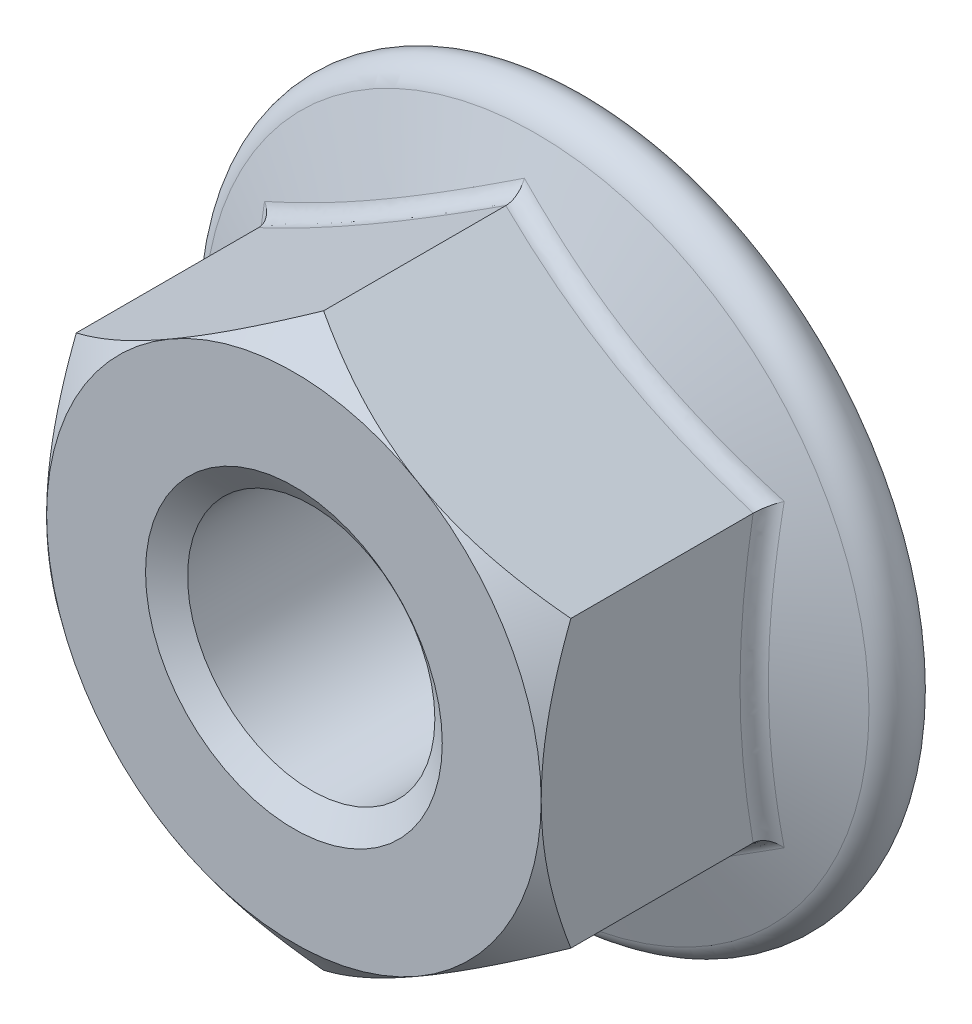
from build123d import *

# Parameters (mm, degrees)
BASENUT_START  = -6
BASENUTSKE_R   = 2.5
BASENUT_DEPTH  = 6
FLANGEFILLET_R = 0.36


# Read off the part's stored shape, not the designer's step: ThreadSchematic
with BuildPart() as part:
    # BaseNutSke → BaseNut (new body)
    with BuildSketch(Plane.XY.offset(BASENUT_START)):
        Polygon((5, 2.886751346), (5, -2.886751346), (0, -5.773502692), (-5, -2.886751346), (-5, 2.886751346), (0, 5.773502692), align=None)
        Circle(BASENUTSKE_R, mode=Mode.SUBTRACT)
    extrude(amount=BASENUT_DEPTH)

    # Sketch5 (on Right Plane) → EndChamfer (revolve, cut)
    with BuildSketch(Plane(origin=(0, 0, 0), x_dir=(0, 0, -1), z_dir=(1, 0, 0))):
        Polygon((5.9746, 3), (5.589485854, 2.45), (6.0254, 2.45), (6.0254, 3), align=None)
    revolve(axis=Axis((0, 2.45, -6.0254), (0, 0, 1)), mode=Mode.SUBTRACT)

    # Sketch6 → Flange (revolve)
    with BuildSketch(Plane(origin=(0, 0, 0), x_dir=(0, 0, -1), z_dir=(1, 0, 0)), mode=Mode.PRIVATE) as flange_sk:
        with BuildLine():
            Line((3.361548952, 2.5), (4.9, 6.726859517))
            ThreePointArc((4.9, 6.726859517), (5.531375747, 7.091384474), (6, 6.532899838))
            Line((6, 6.532899838), (6, 2.5))
            Line((6, 2.5), (3.361548952, 2.5))
        make_face()
    revolve(flange_sk.sketch.rotate(Axis((0, 0, 0), (0, 0, -1)), 90), axis=Axis((0, 0, 0), (0, 0, -1)))

    # Sketch3 → Double-Chamfer (revolve, cut)
    with BuildSketch(Plane(origin=(0, 0, 0), x_dir=(0, 0, -1), z_dir=(1, 0, 0)), mode=Mode.PRIVATE) as double_chamfer_sk:
        Polygon((0.6, 18.473502692), (-12.7, 18.473502692), (-12.7, 5), (0, 5), (0.6, 5.773502692), align=None)
    revolve(double_chamfer_sk.sketch.rotate(Axis((0, 0, 0), (0, 0, -1)), 90), axis=Axis((0, 0, 0), (0, 0, -1)), mode=Mode.SUBTRACT)

    # FlangeFillet
    flangefillet_edges = [part.edges().sort_by_distance(p)[0] for p in [
        (5, 1.449672147, -4.34642141),
        (2.5, 4.330127019, -4.271474537),
        (-2.5, 4.330127019, -4.271474537),
        (-5, 0, -4.271474537),
        (-2.5, -4.330127019, -4.271474537),
        (2.5, -4.330127019, -4.271474537),
        (5, -1.449672147, -4.34642141),
    ]]
    fillet(flangefillet_edges, radius=FLANGEFILLET_R)

    # ThreadSchematic outline → ThreadSchematic (revolve, cut)
    with BuildSketch(Plane.XZ):
        Polygon((2.5, 0), (2.5, -0.350103769), (3, 0), align=None)
        Polygon((3, -5.9746), (2.5, -5.624496231), (2.5, -6), (3, -6), align=None)
    revolve(axis=Axis((0, 0, 0), (0, 0, 1)), mode=Mode.SUBTRACT)


solid = part.part
